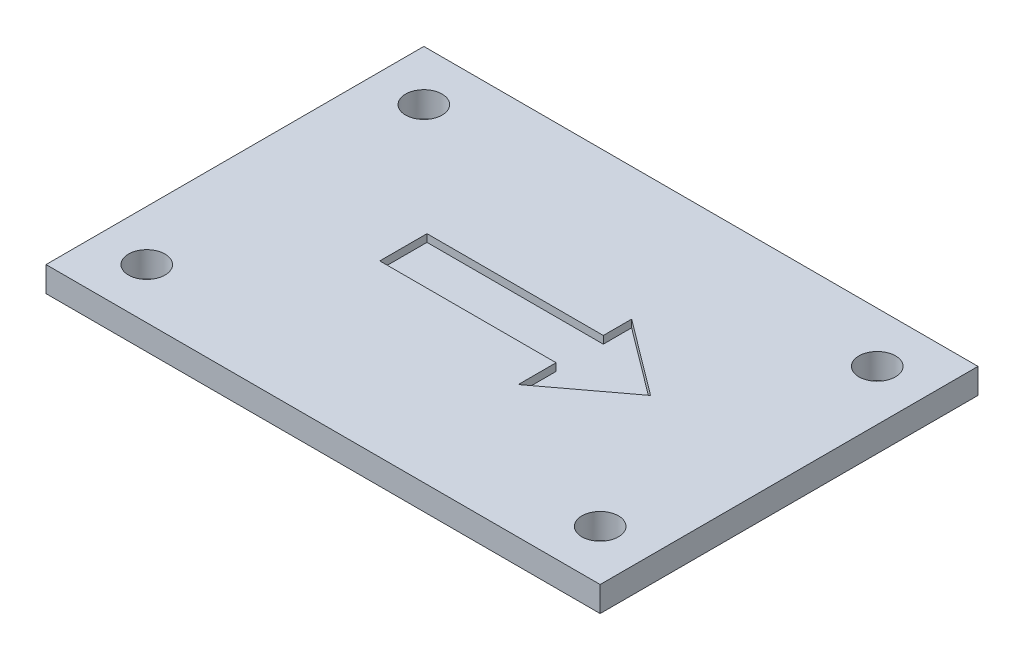
from build123d import *

# Parameters (mm, degrees)
SKETCH1_W             = 44
SKETCH1_H             = 30
LID_PLATE_DEPTH       = 2
SKETCH2_R             = 1.45
CLEARANCE_HOLES_DEPTH = 3
FORWARD_ARROW_X_DEPTH = 0.6


with BuildPart() as part:
    # Sketch1 → Lid Plate (new body)
    with BuildSketch(Plane(origin=(0, 0, 0), x_dir=(1, 0, 0), z_dir=(0, 1, 0))):
        Rectangle(SKETCH1_W, SKETCH1_H)
    extrude(amount=LID_PLATE_DEPTH)

    # Sketch2 → Clearance Holes (cut)
    with BuildSketch(Plane(origin=(0, 2, 0), x_dir=(1, 0, 0), z_dir=(0, 1, 0))):
        with Locations((-18, -11)):
            Circle(SKETCH2_R)
        with Locations((-18, 11)):
            Circle(SKETCH2_R)
        with Locations((18, -11)):
            Circle(SKETCH2_R)
        with Locations((18, 11)):
            Circle(SKETCH2_R)
    extrude(amount=-CLEARANCE_HOLES_DEPTH, mode=Mode.SUBTRACT)

    # Sketch3 → Forward Arrow (+X) (cut)
    with BuildSketch(Plane(origin=(0, 2, 0), x_dir=(1, 0, 0), z_dir=(0, 1, 0))):
        Polygon((-9, -1.5), (5, -1.5), (5, -4.5), (11, 0), (5, 4.5), (5, 2.25), (-9, 2.25), align=None)
    extrude(amount=-FORWARD_ARROW_X_DEPTH, mode=Mode.SUBTRACT)


solid = part.part
